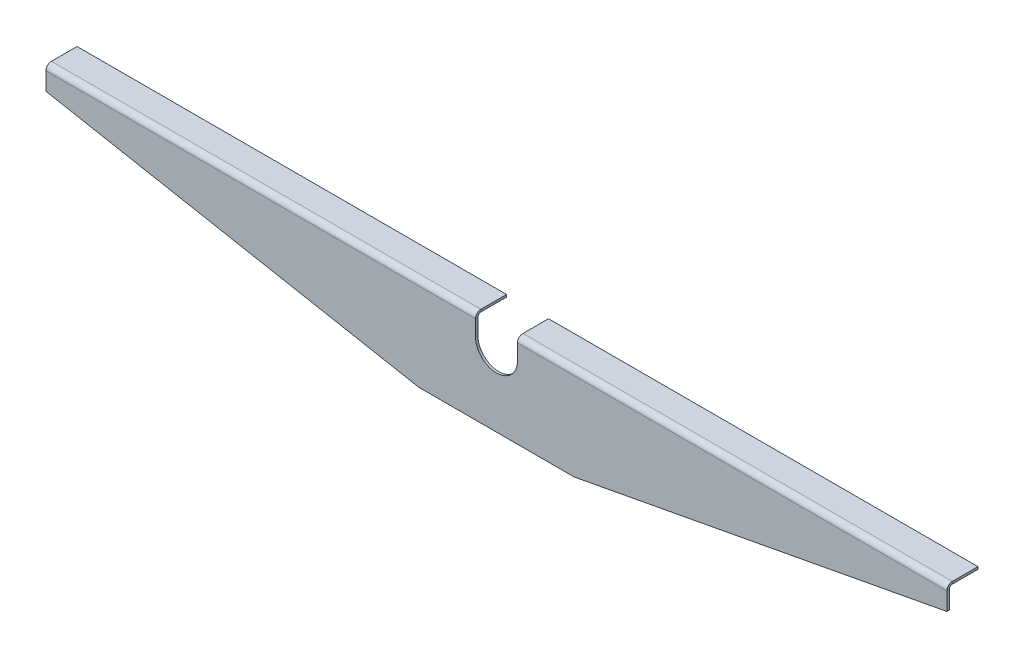
from build123d import *

# Parameters (mm, degrees)
BASE_FLANGE2_DEPTH           = 1.5
EDGE_FLANGE1_STRIP_W         = 10
EDGE_FLANGE1_STRIP_H         = 1.5
EDGE_FLANGE1_STRIP_CUT_DEPTH = 580
EDGE_FLANGE1_DEPTH           = 580
CUT_EXTRUDE1_DEPTH           = 295.957624075


# Sheet-metal steps are written as plain solids
with BuildPart() as part:
    # Sketch1 → Base-Flange2 (new body)
    with BuildSketch(Plane.XY):
        Polygon((-290, 10), (290, 10), (290, -5), (50, -50), (-50, -50), (-290, -5), align=None)
    extrude(amount=-BASE_FLANGE2_DEPTH)

    # Edge-Flange1 strip (across the edge) → Edge-Flange1 strip cut (cut)
    with BuildSketch(Plane(origin=(-290, 10, -1.5), x_dir=(0, -1, 0), z_dir=(1, 0, 0))):
        with Locations((-1.5, -0.75)):
            Rectangle(EDGE_FLANGE1_STRIP_W, EDGE_FLANGE1_STRIP_H)
    extrude(amount=EDGE_FLANGE1_STRIP_CUT_DEPTH, mode=Mode.SUBTRACT)

    # Edge-Flange1 section (across the edge) → Edge-Flange1 (add)
    with BuildSketch(Plane(origin=(-290, 10, -1.5), x_dir=(0, -1, 0), z_dir=(1, 0, 0))):
        with BuildLine():
            Line((0, 2), (0, 18.5))
            Line((0, 18.5), (1.5, 18.5))
            Line((1.5, 18.5), (1.5, 2))
            ThreePointArc((1.5, 2), (2.085786438, 0.585786438), (3.5, 0))
            Line((3.5, 0), (3.5, -1.5))
            ThreePointArc((3.5, -1.5), (1.025126266, -0.474873734), (0, 2))
        make_face()
    extrude(amount=EDGE_FLANGE1_DEPTH)

    # Sketch13 → Cut-Extrude1 (cut, through all)
    with BuildSketch(Plane.XY):
        with BuildLine():
            Line((-13.5, -3.5), (-13.5, 21.0126417))
            Line((-13.5, 21.0126417), (13.5, 21.0126417))
            Line((13.5, 21.0126417), (13.5, -3.5))
            ThreePointArc((13.5, -3.5), (0, -17), (-13.5, -3.5))
        make_face()
    extrude(amount=-CUT_EXTRUDE1_DEPTH, mode=Mode.SUBTRACT)


solid = part.part
